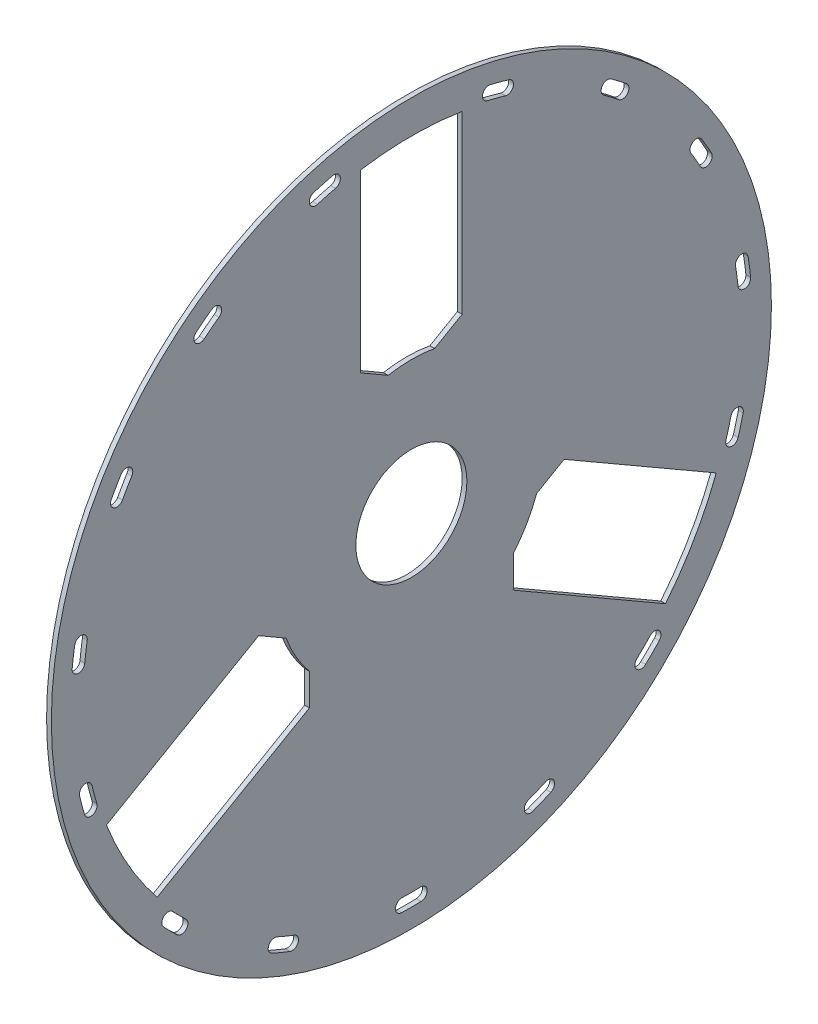
from build123d import *

# Parameters (mm, degrees)
SKETCH_1_R               = 113.5
SKETCH_1_R_2             = 17.5
EXTRUDE_1_DEPTH          = 1.5
CUT_EXTRUDE_1_DEPTH      = 161.520247944
CUT_EXTRUDE_2_DEPTH      = 161.520247944
PATTERN_CIRCULAR_1_COUNT = 3


with BuildPart() as part:
    # Эскиз1 → Бобышка-Вытянуть1 (new body)
    with BuildSketch(Plane(origin=(0, 0, 0), x_dir=(0, 0, -1), z_dir=(1, 0, 0))):
        Circle(SKETCH_1_R)
        Circle(SKETCH_1_R_2, mode=Mode.SUBTRACT)
    extrude(amount=EXTRUDE_1_DEPTH)

    # Эскиз2 → Вырез-Вытянуть1 (cut, through all)
    with BuildSketch(Plane.ZY):
        with BuildLine():
            Line((-16, 101.749692874), (-16, 46.353695472))
            Line((-16, 46.353695472), (-7.339745962, 41.353695472))
            ThreePointArc((-7.339745962, 41.353695472), (0, 42), (7.339745962, 41.353695472))
            Line((7.339745962, 41.353695472), (16, 46.353695472))
            Line((16, 46.353695472), (16, 101.749692874))
            ThreePointArc((16, 101.749692874), (0, 103), (-16, 101.749692874))
        make_face()
        with BuildLine():
            Line((96.117818856, -37.018439977), (48.143477838, -9.320441276))
            Line((48.143477838, -9.320441276), (39.4832238, -14.320441276))
            ThreePointArc((39.4832238, -14.320441276), (36.373066959, -21), (32.143477838, -27.033254197))
            Line((32.143477838, -27.033254197), (32.143477838, -37.033254197))
            Line((32.143477838, -37.033254197), (80.117818856, -64.731252898))
            ThreePointArc((80.117818856, -64.731252898), (89.20061659, -51.5), (96.117818856, -37.018439977))
        make_face()
        with BuildLine():
            Line((-80.117818856, -64.731252898), (-32.143477838, -37.033254197))
            Line((-32.143477838, -37.033254197), (-32.143477838, -27.033254197))
            ThreePointArc((-32.143477838, -27.033254197), (-36.373066959, -21), (-39.4832238, -14.320441276))
            Line((-39.4832238, -14.320441276), (-48.143477838, -9.320441276))
            Line((-48.143477838, -9.320441276), (-96.117818856, -37.018439977))
            ThreePointArc((-96.117818856, -37.018439977), (-89.20061659, -51.5), (-80.117818856, -64.731252898))
        make_face()
    extrude(amount=-CUT_EXTRUDE_1_DEPTH, mode=Mode.SUBTRACT)

    # Эскиз3 → Вырез-Вытянуть2 (cut, through all)
    with BuildSketch(Plane.ZY):
        with BuildLine():
            ThreePointArc((-78.144774985, -73.821705091), (-76.013978978, -76.013978978), (-73.821705091, -78.144774985))
            ThreePointArc((-73.821705091, -78.144774985), (-70.994421741, -78.064345778), (-71.074850948, -75.237062428))
            ThreePointArc((-71.074850948, -75.237062428), (-73.185551853, -73.185551853), (-75.237062428, -71.074850948))
            ThreePointArc((-75.237062428, -71.074850948), (-78.064345778, -70.994421741), (-78.144774985, -73.821705091))
        make_face()
        with BuildLine():
            ThreePointArc((-43.946014694, -98.107073101), (-41.138468979, -99.317049745), (-38.297651676, -100.446701669))
            ThreePointArc((-38.297651676, -100.446701669), (-35.716361381, -99.290440274), (-36.872622776, -96.709149979))
            ThreePointArc((-36.872622776, -96.709149979), (-39.60773525, -95.621531615), (-42.310814148, -94.456577358))
            ThreePointArc((-42.310814148, -94.456577358), (-44.953662293, -95.464224956), (-43.946014694, -98.107073101))
        make_face()
        with BuildLine():
            ThreePointArc((-3.056872038, -107.456528575), (0, -107.5), (3.056872038, -107.456528575))
            ThreePointArc((3.056872038, -107.456528575), (4.999191229, -105.400465308), (2.943127962, -103.458146116))
            ThreePointArc((2.943127962, -103.458146116), (0, -103.5), (-2.943127962, -103.458146116))
            ThreePointArc((-2.943127962, -103.458146116), (-4.999191229, -105.400465308), (-3.056872038, -107.456528575))
        make_face()
        with BuildLine():
            ThreePointArc((43.946014694, -98.107073101), (41.138468979, -99.317049745), (38.297651676, -100.446701669))
            ThreePointArc((38.297651676, -100.446701669), (35.716361381, -99.290440274), (36.872622776, -96.709149979))
            ThreePointArc((36.872622776, -96.709149979), (39.60773525, -95.621531615), (42.310814148, -94.456577358))
            ThreePointArc((42.310814148, -94.456577358), (44.953662293, -95.464224956), (43.946014694, -98.107073101))
        make_face()
        with BuildLine():
            ThreePointArc((78.144774985, -73.821705091), (76.013978978, -76.013978978), (73.821705091, -78.144774985))
            ThreePointArc((73.821705091, -78.144774985), (70.994421741, -78.064345778), (71.074850948, -75.237062428))
            ThreePointArc((71.074850948, -75.237062428), (73.185551853, -73.185551853), (75.237062428, -71.074850948))
            ThreePointArc((75.237062428, -71.074850948), (78.064345778, -70.994421741), (78.144774985, -73.821705091))
        make_face()
    cut_extrude_2 = extrude(amount=-CUT_EXTRUDE_2_DEPTH, mode=Mode.SUBTRACT)

    # Круговой массив1: Вырез-Вытянуть2 ×3 about axis
    pattern_circular_1_axis = Axis((0, 0, 0), (1, 0, 0))
    for i in range(1, PATTERN_CIRCULAR_1_COUNT):
        add(cut_extrude_2.rotate(pattern_circular_1_axis, i * 360 / PATTERN_CIRCULAR_1_COUNT), mode=Mode.SUBTRACT)


solid = part.part
